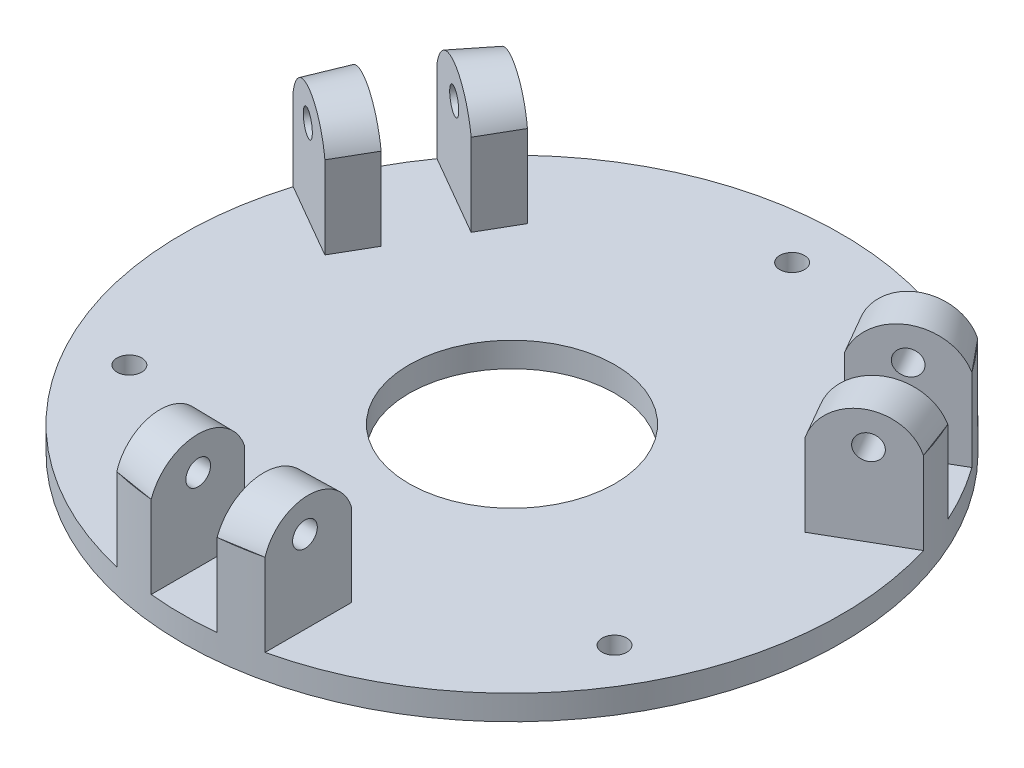
from build123d import *

# Parameters (mm, degrees)
SKETCH1_R           = 40
SKETCH1_R_2         = 12.5
BOSS_EXTRUDE1_DEPTH = 3
BOSS_EXTRUDE5_DEPTH = 10
SKETCH20_R          = 1.5
CUT_EXTRUDE3_DEPTH  = 5
SKETCH22_R          = 1.5
CUT_EXTRUDE4_DEPTH  = 10
CIRPATTERN1_COUNT   = 3
SKETCH24_R          = 1.5
CUT_EXTRUDE5_DEPTH  = 10
CIRPATTERN2_COUNT   = 3


with BuildPart() as part:
    # Sketch1 → Boss-Extrude1 (new body)
    with BuildSketch(Plane(origin=(0, 0, 0), x_dir=(1, 0, 0), z_dir=(0, 1, 0))):
        with Locations(Location((0, 0, 0), (0, 0, 270))):
            Circle(SKETCH1_R)
        with Locations(Location((0, 0, 0), (0, 0, 270))):
            Circle(SKETCH1_R_2, mode=Mode.SUBTRACT)
    extrude(amount=BOSS_EXTRUDE1_DEPTH)

    # Sketch8 → Boss-Extrude5 (add)
    with BuildSketch(Plane(origin=(0, 3, 0), x_dir=(1, 0, 0), z_dir=(0, 1, 0))):
        with BuildLine():
            Line((-4, -39.799497484), (-4, -28.466262232))
            Line((-4, -28.466262232), (-9, -28.466262232))
            Line((-9, -28.466262232), (-9, -38.97435054))
            ThreePointArc((-9, -38.97435054), (-6.513080444, -39.466185313), (-4, -39.799497484))
        make_face()
        with BuildLine():
            Line((4, -28.466262232), (4, -39.799497484))
            ThreePointArc((4, -39.799497484), (6.513080444, -39.466185313), (9, -38.97435054))
            Line((9, -38.97435054), (9, -28.466262232))
            Line((9, -28.466262232), (4, -28.466262232))
        make_face()
    boss_extrude5 = extrude(amount=BOSS_EXTRUDE5_DEPTH)

    # Sketch9 for Loft4 → Loft4 section 0
    with BuildSketch(Plane(origin=(9, 0, 0), x_dir=(0, 0, -1), z_dir=(1, 0, 0))):
        with BuildLine():
            Line((-28.466262232, 13), (-38.97435054, 13))
            # circular arc as an exact rational Bezier (weights 1, cos(half-angle), 1)
            Bezier((-38.97435054, 13), (-33.720306386, 30.574863042), (-28.466262232, 13), weights=[1, 0.286426753, 1])
        make_face()
    # Sketch10 for Loft4 → Loft4 section 1
    with BuildSketch(Plane.ZY.offset(-4)):
        with BuildLine():
            Line((28.466262232, 13), (39.799497484, 13))
            Bezier((39.799497484, 13), (34.132879858, 28.686313092), (28.466262232, 13), weights=[1, 0.339756679, 1])
        make_face()
    loft4 = loft()

    # Loft7: read off the stored shape, not the designer's step
    # Loft7: loft between two sections, ruled curve by curve
    loft7_from = [
        Edge.make_bspline([(-4, 13, 39.799497484), (-4, 13.445887075, 39.644015382), (-4, 13.912406496, 39.42235746), (-4, 14.83103025, 38.804929607), (-4, 15.282819738, 38.407898984), (-4, 16.078747391, 37.428773866), (-4, 16.421172618, 36.845868146), (-4, 16.895486355, 35.552548175), (-4, 17.025283738, 34.843378132), (-4, 17.025283738, 33.422381584), (-4, 16.895486355, 32.713211541), (-4, 16.421172618, 31.419891571), (-4, 16.078747391, 30.83698585), (-4, 15.282819738, 29.857860733), (-4, 14.83103025, 29.460830109), (-4, 13.912406496, 28.843402256), (-4, 13.445887075, 28.621744334), (-4, 13, 28.466262232)], [0, 0, 0, 0, 0.125, 0.125, 0.25, 0.25, 0.375, 0.375, 0.5, 0.5, 0.625, 0.625, 0.75, 0.75, 0.875, 0.875, 1, 1, 1, 1], 3),
        Edge.make_line((-4, 13, 28.466262232), (-4, 13, 39.799497484)),
    ]
    loft7_to = [
        Edge.make_bspline([(-9, 13, 38.97435054), (-9, 13.419469841, 38.848866269), (-9, 13.863009903, 38.66161005), (-9, 14.746425178, 38.117380283), (-9, 15.186117881, 37.75901052), (-9, 15.967952584, 36.854602056), (-9, 16.308267994, 36.307496065), (-9, 16.781693902, 35.08000068), (-9, 16.912355403, 34.400917098), (-9, 16.912355403, 33.039695674), (-9, 16.781693902, 32.360612092), (-9, 16.308267994, 31.133116706), (-9, 15.967952584, 30.586010716), (-9, 15.186117881, 29.681602252), (-9, 14.746425178, 29.323232488), (-9, 13.863009903, 28.779002722), (-9, 13.419469841, 28.591746503), (-9, 13, 28.466262232)], [0, 0, 0, 0, 0.125, 0.125, 0.25, 0.25, 0.375, 0.375, 0.5, 0.5, 0.625, 0.625, 0.75, 0.75, 0.875, 0.875, 1, 1, 1, 1], 3),
        Edge.make_line((-9, 13, 28.466262232), (-9, 13, 38.97435054)),
    ]
    loft7 = Solid(Shell([*[Face.make_surface_from_curves(loft7_from[k], loft7_to[k]) for k in range(2)], Face(Wire(loft7_from)), Face(Wire(loft7_to))]))
    add(loft7)

    # Sketch20 → Cut-Extrude3 (cut)
    with BuildSketch(Plane.ZY.offset(-4)):
        with Locations((34.132879858, 13)):
            Circle(SKETCH20_R)
    cut_extrude3 = extrude(amount=-CUT_EXTRUDE3_DEPTH, mode=Mode.SUBTRACT)

    # Sketch22 → Cut-Extrude4 (cut)
    with BuildSketch(Plane(origin=(-4, 0, 0), x_dir=(0, 0, -1), z_dir=(1, 0, 0))):
        with Locations((-34.090737301, 12.972785767)):
            Circle(SKETCH22_R)
    cut_extrude4 = extrude(amount=-CUT_EXTRUDE4_DEPTH, mode=Mode.SUBTRACT)

    # CirPattern1: Boss-Extrude5, Loft4, Loft7, Cut-Extrude3, Cut-Extrude4 ×3 about axis
    cirpattern1_axis = Axis((0, 0, 0), (0, 1, 0))
    add([boss_extrude5.rotate(cirpattern1_axis, i * 360 / CIRPATTERN1_COUNT) for i in range(1, CIRPATTERN1_COUNT)])
    add([loft4.rotate(cirpattern1_axis, i * 360 / CIRPATTERN1_COUNT) for i in range(1, CIRPATTERN1_COUNT)])
    add([loft7.rotate(cirpattern1_axis, i * 360 / CIRPATTERN1_COUNT) for i in range(1, CIRPATTERN1_COUNT)])
    add([cut_extrude3.rotate(cirpattern1_axis, i * 360 / CIRPATTERN1_COUNT) for i in range(1, CIRPATTERN1_COUNT)], mode=Mode.SUBTRACT)
    add([cut_extrude4.rotate(cirpattern1_axis, i * 360 / CIRPATTERN1_COUNT) for i in range(1, CIRPATTERN1_COUNT)], mode=Mode.SUBTRACT)

    # Sketch24 → Cut-Extrude5 (cut)
    with BuildSketch(Plane(origin=(0, 3, 0), x_dir=(1, 0, 0), z_dir=(0, 1, 0))):
        with Locations(Location((29.444863729, -17, 0), (0, 0, 270))):
            Circle(SKETCH24_R)
    cut_extrude5 = extrude(amount=-CUT_EXTRUDE5_DEPTH, mode=Mode.SUBTRACT)

    # CirPattern2: Cut-Extrude5 ×3 about axis
    cirpattern2_axis = Axis((0, 0, 0), (0, 1, 0))
    for i in range(1, CIRPATTERN2_COUNT):
        add(cut_extrude5.rotate(cirpattern2_axis, i * 360 / CIRPATTERN2_COUNT), mode=Mode.SUBTRACT)


solid = part.part
